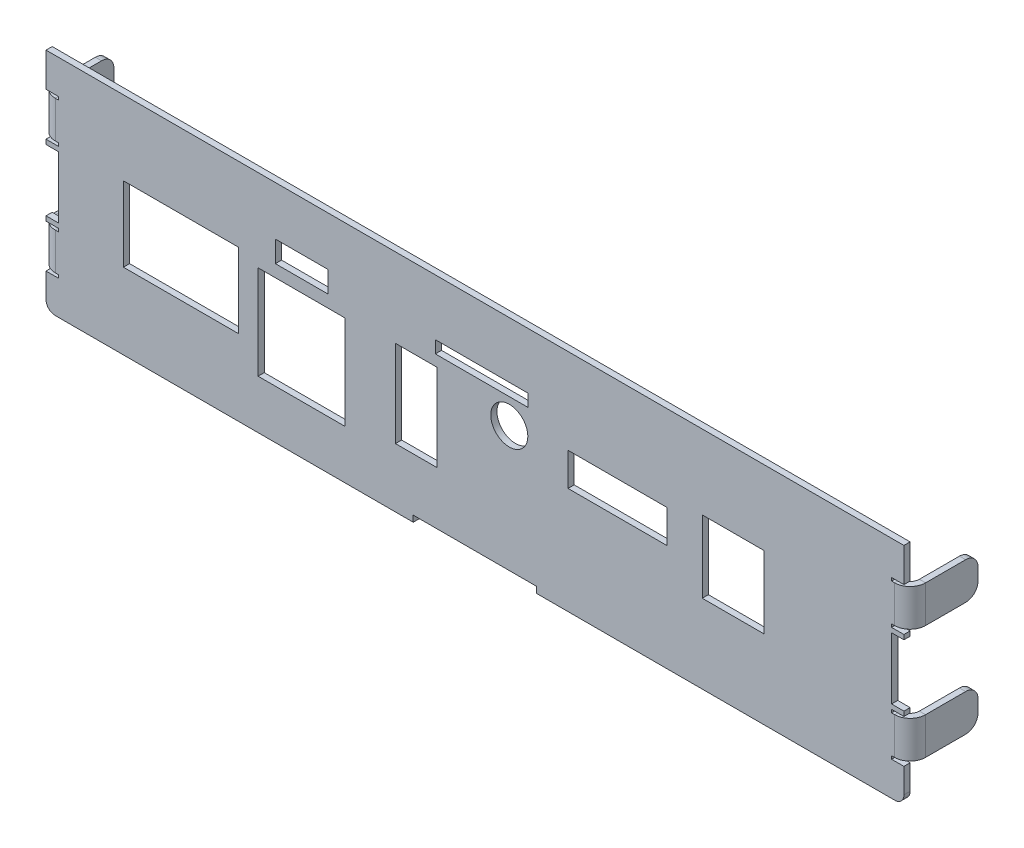
from build123d import *

# Parameters (mm, degrees)
SKETCH1_W                       = 139
SKETCH1_H                       = 36.5
BASE_FLANGE1_DEPTH              = 1
EDGE_FLANGE1_STRIP_W            = 7
EDGE_FLANGE1_STRIP_H            = 1
EDGE_FLANGE1_STRIP_CUT_DEPTH    = 6
EDGE_FLANGE1_RELIEF_W           = 7.5
EDGE_FLANGE1_RELIEF_H           = 0.5
EDGE_FLANGE1_RELIEF_CUT_DEPTH   = 1
EDGE_FLANGE1_STRIP_2_W          = 7
EDGE_FLANGE1_STRIP_2_H          = 1
EDGE_FLANGE1_STRIP_CUT_2_DEPTH  = 6
EDGE_FLANGE1_RELIEF_2_W         = 7.5
EDGE_FLANGE1_RELIEF_2_H         = 0.5
EDGE_FLANGE1_RELIEF_CUT_2_DEPTH = 1
EDGE_FLANGE1_DEPTH              = 6
EDGE_FLANGE1_START              = -1
EDGE_FLANGE1_FLAT_DEPTH         = 1
EDGE_FLANGE1_BEND_DEPTH         = 6
EDGE_FLANGE1_FLAT_2_DEPTH       = 1
EDGE_FLANGE2_STRIP_W            = 7
EDGE_FLANGE2_STRIP_H            = 1
EDGE_FLANGE2_STRIP_CUT_DEPTH    = 6
EDGE_FLANGE2_RELIEF_W           = 7.5
EDGE_FLANGE2_RELIEF_H           = 0.5
EDGE_FLANGE2_RELIEF_CUT_DEPTH   = 1
EDGE_FLANGE2_STRIP_2_W          = 7
EDGE_FLANGE2_STRIP_2_H          = 1
EDGE_FLANGE2_STRIP_CUT_2_DEPTH  = 6
EDGE_FLANGE2_RELIEF_2_W         = 7.5
EDGE_FLANGE2_RELIEF_2_H         = 0.5
EDGE_FLANGE2_RELIEF_CUT_2_DEPTH = 1
EDGE_FLANGE2_DEPTH              = 6
EDGE_FLANGE2_START              = 1
EDGE_FLANGE2_FLAT_DEPTH         = 1
EDGE_FLANGE2_BEND_DEPTH         = 6
EDGE_FLANGE2_FLAT_2_DEPTH       = 1
SKETCH20_W                      = 20
SKETCH20_H                      = 1
SKETCH20_W_2                    = 2
SKETCH20_H_2                    = 10
CUT_EXTRUDE1_DEPTH              = 10
FILLET1_R                       = 1.5
SKETCH21_W                      = 15
SKETCH21_H                      = 2
SKETCH21_W_2                    = 17.619171599
SKETCH21_H_2                    = 11.12514716
SKETCH21_W_3                    = 13.1
SKETCH21_H_3                    = 14.209512824
SKETCH21_W_4                    = 5.75
SKETCH21_H_4                    = 13.075429167
SKETCH21_H_5                    = 4.35
CUT_EXTRUDE2_DEPTH              = 10
SKETCH22_R                      = 3
SKETCH22_W                      = 8.50018288
SKETCH22_H                      = 3.45
SKETCH22_W_2                    = 10.00000232
SKETCH22_H_2                    = 11.697941419
SKETCH22_W_3                    = 18.619171599
SKETCH22_H_3                    = 12.12514716
SKETCH22_W_4                    = 17.619171599
SKETCH22_H_4                    = 11.12514716
SKETCH22_W_5                    = 14.1
SKETCH22_H_5                    = 15.209512824
SKETCH22_W_6                    = 13.1
SKETCH22_H_6                    = 14.209512824
SKETCH22_W_7                    = 6.75
SKETCH22_H_7                    = 14.075429167
SKETCH22_W_8                    = 5.75
SKETCH22_H_8                    = 13.075429167
SKETCH22_W_9                    = 16
SKETCH22_H_9                    = 5.35
SKETCH22_W_10                   = 15
SKETCH22_H_10                   = 4.35
CUT_EXTRUDE3_DEPTH              = 10


# Sheet-metal steps are written as plain solids
with BuildPart() as part:
    # Sketch1 → Base-Flange1 (new body)
    with BuildSketch(Plane.XY):
        with Locations((0.929014267, 0)):
            Rectangle(SKETCH1_W, SKETCH1_H)
    extrude(amount=-BASE_FLANGE1_DEPTH)

    # Edge-Flange1 strip (across the edge) → Edge-Flange1 strip cut (cut)
    with BuildSketch(Plane(origin=(-68.570985733, 6.25, -1), x_dir=(1, 0, 0), z_dir=(0, 1, 0))):
        with Locations((-2, -0.5)):
            Rectangle(EDGE_FLANGE1_STRIP_W, EDGE_FLANGE1_STRIP_H)
    extrude(amount=EDGE_FLANGE1_STRIP_CUT_DEPTH, mode=Mode.SUBTRACT)

    # Edge-Flange1 relief (on the sheet) → Edge-Flange1 relief cut (cut)
    with BuildSketch(Plane(origin=(-67.070985733, 6.25, -1), x_dir=(1, 0, 0), z_dir=(0, 0, -1))):
        with Locations((-3.25, 0.25)):
            Rectangle(EDGE_FLANGE1_RELIEF_W, EDGE_FLANGE1_RELIEF_H)
        with Locations((-3.25, -6.25)):
            Rectangle(EDGE_FLANGE1_RELIEF_W, EDGE_FLANGE1_RELIEF_H)
    extrude(amount=-EDGE_FLANGE1_RELIEF_CUT_DEPTH, mode=Mode.SUBTRACT)

    # Edge-Flange1 strip 2 (across the edge) → Edge-Flange1 strip cut 2 (cut)
    with BuildSketch(Plane(origin=(70.429014267, 12.25, -1), x_dir=(-1, 0, 0), z_dir=(0, -1, 0))):
        with Locations((-2, -0.5)):
            Rectangle(EDGE_FLANGE1_STRIP_2_W, EDGE_FLANGE1_STRIP_2_H)
    extrude(amount=EDGE_FLANGE1_STRIP_CUT_2_DEPTH, mode=Mode.SUBTRACT)

    # Edge-Flange1 relief 2 (on the sheet) → Edge-Flange1 relief cut 2 (cut)
    with BuildSketch(Plane(origin=(68.929014267, 12.25, -1), x_dir=(-1, 0, 0), z_dir=(0, 0, -1))):
        with Locations((-3.25, 0.25)):
            Rectangle(EDGE_FLANGE1_RELIEF_2_W, EDGE_FLANGE1_RELIEF_2_H)
        with Locations((-3.25, -6.25)):
            Rectangle(EDGE_FLANGE1_RELIEF_2_W, EDGE_FLANGE1_RELIEF_2_H)
    extrude(amount=-EDGE_FLANGE1_RELIEF_CUT_2_DEPTH, mode=Mode.SUBTRACT)

    # Edge-Flange1 bend section (across the edge) → Edge-Flange1 (add)
    with BuildSketch(Plane(origin=(-68.570985733, 6.25, -1), x_dir=(1, 0, 0), z_dir=(0, 1, 0))):
        with BuildLine():
            Line((-1, 1.5), (0, 1.5))
            ThreePointArc((0, 1.5), (0.439339828, 0.439339828), (1.5, 0))
            Line((1.5, 0), (1.5, -1))
            ThreePointArc((1.5, -1), (-0.267766953, -0.267766953), (-1, 1.5))
        make_face()
    extrude(amount=EDGE_FLANGE1_DEPTH)

    # Edge-Flange1 profile (on flange) → Edge-Flange1 flat (add)
    with BuildSketch(Plane(origin=(-68.570985733, 0, -1), x_dir=(0, -1, 0), z_dir=(1, 0, 0)).offset(EDGE_FLANGE1_START)):
        with BuildLine():
            ThreePointArc((-6.25, 8), (-6.835786438, 9.414213562), (-8.25, 10))
            Line((-8.25, 10), (-10.25, 10))
            ThreePointArc((-10.25, 10), (-11.664213562, 9.414213562), (-12.25, 8))
            Line((-12.25, 8), (-12.25, 1.5))
            Line((-12.25, 1.5), (-6.25, 1.5))
            Line((-6.25, 1.5), (-6.25, 8))
        make_face()
    extrude(amount=EDGE_FLANGE1_FLAT_DEPTH)

    # Edge-Flange1 bend section 2 (across the edge) → Edge-Flange1 bend (add)
    with BuildSketch(Plane(origin=(70.429014267, 12.25, -1), x_dir=(-1, 0, 0), z_dir=(0, -1, 0))):
        with BuildLine():
            Line((-1, 1.5), (0, 1.5))
            ThreePointArc((0, 1.5), (0.439339828, 0.439339828), (1.5, 0))
            Line((1.5, 0), (1.5, -1))
            ThreePointArc((1.5, -1), (-0.267766953, -0.267766953), (-1, 1.5))
        make_face()
    extrude(amount=EDGE_FLANGE1_BEND_DEPTH)

    # Edge-Flange1 profile 2 (on flange) → Edge-Flange1 flat 2 (add)
    with BuildSketch(Plane(origin=(70.429014267, 0, -1), x_dir=(0, 1, 0), z_dir=(-1, 0, 0)).offset(EDGE_FLANGE1_START)):
        with BuildLine():
            Line((12.25, 1.5), (12.25, 8))
            ThreePointArc((12.25, 8), (11.664213562, 9.414213562), (10.25, 10))
            Line((10.25, 10), (8.25, 10))
            ThreePointArc((8.25, 10), (6.835786438, 9.414213562), (6.25, 8))
            Line((6.25, 8), (6.25, 1.5))
            Line((6.25, 1.5), (12.25, 1.5))
        make_face()
    extrude(amount=EDGE_FLANGE1_FLAT_2_DEPTH)

    # Edge-Flange2 strip (across the edge) → Edge-Flange2 strip cut (cut)
    with BuildSketch(Plane(origin=(70.429014267, -6.25, -1), x_dir=(-1, 0, 0), z_dir=(0, -1, 0))):
        with Locations((-2, -0.5)):
            Rectangle(EDGE_FLANGE2_STRIP_W, EDGE_FLANGE2_STRIP_H)
    extrude(amount=EDGE_FLANGE2_STRIP_CUT_DEPTH, mode=Mode.SUBTRACT)

    # Edge-Flange2 relief (on the sheet) → Edge-Flange2 relief cut (cut)
    with BuildSketch(Plane(origin=(68.929014267, -6.25, -1), x_dir=(-1, 0, 0), z_dir=(0, 0, -1))):
        with Locations((-3.25, 0.25)):
            Rectangle(EDGE_FLANGE2_RELIEF_W, EDGE_FLANGE2_RELIEF_H)
        with Locations((-3.25, -6.25)):
            Rectangle(EDGE_FLANGE2_RELIEF_W, EDGE_FLANGE2_RELIEF_H)
    extrude(amount=-EDGE_FLANGE2_RELIEF_CUT_DEPTH, mode=Mode.SUBTRACT)

    # Edge-Flange2 strip 2 (across the edge) → Edge-Flange2 strip cut 2 (cut)
    with BuildSketch(Plane(origin=(-68.570985733, -12.25, -1), x_dir=(1, 0, 0), z_dir=(0, 1, 0))):
        with Locations((-2, -0.5)):
            Rectangle(EDGE_FLANGE2_STRIP_2_W, EDGE_FLANGE2_STRIP_2_H)
    extrude(amount=EDGE_FLANGE2_STRIP_CUT_2_DEPTH, mode=Mode.SUBTRACT)

    # Edge-Flange2 relief 2 (on the sheet) → Edge-Flange2 relief cut 2 (cut)
    with BuildSketch(Plane(origin=(-67.070985733, -12.25, -1), x_dir=(1, 0, 0), z_dir=(0, 0, -1))):
        with Locations((-3.25, 0.25)):
            Rectangle(EDGE_FLANGE2_RELIEF_2_W, EDGE_FLANGE2_RELIEF_2_H)
        with Locations((-3.25, -6.25)):
            Rectangle(EDGE_FLANGE2_RELIEF_2_W, EDGE_FLANGE2_RELIEF_2_H)
    extrude(amount=-EDGE_FLANGE2_RELIEF_CUT_2_DEPTH, mode=Mode.SUBTRACT)

    # Edge-Flange2 bend section (across the edge) → Edge-Flange2 (add)
    with BuildSketch(Plane(origin=(70.429014267, -6.25, -1), x_dir=(-1, 0, 0), z_dir=(0, -1, 0))):
        with BuildLine():
            Line((-1, 1.5), (0, 1.5))
            ThreePointArc((0, 1.5), (0.439339828, 0.439339828), (1.5, 0))
            Line((1.5, 0), (1.5, -1))
            ThreePointArc((1.5, -1), (-0.267766953, -0.267766953), (-1, 1.5))
        make_face()
    extrude(amount=EDGE_FLANGE2_DEPTH)

    # Edge-Flange2 profile (on flange) → Edge-Flange2 flat (add)
    with BuildSketch(Plane(origin=(70.429014267, 0, -1), x_dir=(0, -1, 0), z_dir=(1, 0, 0)).offset(EDGE_FLANGE2_START)):
        with BuildLine():
            Line((12.25, 1.5), (12.25, 8))
            ThreePointArc((12.25, 8), (11.664213562, 9.414213562), (10.25, 10))
            Line((10.25, 10), (8.25, 10))
            ThreePointArc((8.25, 10), (6.835786438, 9.414213562), (6.25, 8))
            Line((6.25, 8), (6.25, 1.5))
            Line((6.25, 1.5), (12.25, 1.5))
        make_face()
    extrude(amount=-EDGE_FLANGE2_FLAT_DEPTH)

    # Edge-Flange2 bend section 2 (across the edge) → Edge-Flange2 bend (add)
    with BuildSketch(Plane(origin=(-68.570985733, -12.25, -1), x_dir=(1, 0, 0), z_dir=(0, 1, 0))):
        with BuildLine():
            Line((-1, 1.5), (0, 1.5))
            ThreePointArc((0, 1.5), (0.439339828, 0.439339828), (1.5, 0))
            Line((1.5, 0), (1.5, -1))
            ThreePointArc((1.5, -1), (-0.267766953, -0.267766953), (-1, 1.5))
        make_face()
    extrude(amount=EDGE_FLANGE2_BEND_DEPTH)

    # Edge-Flange2 profile 2 (on flange) → Edge-Flange2 flat 2 (add)
    with BuildSketch(Plane(origin=(-68.570985733, 0, -1), x_dir=(0, 1, 0), z_dir=(-1, 0, 0)).offset(EDGE_FLANGE2_START)):
        with BuildLine():
            ThreePointArc((-6.25, 8), (-6.835786438, 9.414213562), (-8.25, 10))
            Line((-8.25, 10), (-10.25, 10))
            ThreePointArc((-10.25, 10), (-11.664213562, 9.414213562), (-12.25, 8))
            Line((-12.25, 8), (-12.25, 1.5))
            Line((-12.25, 1.5), (-6.25, 1.5))
            Line((-6.25, 1.5), (-6.25, 8))
        make_face()
    extrude(amount=-EDGE_FLANGE2_FLAT_2_DEPTH)

    # Sketch20 → Cut-Extrude1 (cut)
    with BuildSketch(Plane(origin=(0, 0, -1), x_dir=(-1, 0, 0), z_dir=(0, 0, -1))):
        with Locations((-0.929014267, -17.75)):
            Rectangle(SKETCH20_W, SKETCH20_H)
        with Locations((-69.429014267, 0)):
            Rectangle(SKETCH20_W_2, SKETCH20_H_2)
        with Locations((67.570985733, 0)):
            Rectangle(SKETCH20_W_2, SKETCH20_H_2)
    extrude(amount=-CUT_EXTRUDE1_DEPTH, mode=Mode.SUBTRACT)

    # Fillet1
    fillet1_edges = [part.edges().sort_by_distance(p)[0] for p in [
        (70.429014267, -18.25, -0.5),
        (-68.570985733, -18.25, -0.5),
    ]]
    fillet(fillet1_edges, radius=FILLET1_R)

    # Sketch21 → Cut-Extrude2 (cut)
    with BuildSketch(Plane.XY):
        with Locations((2.010056647, 8.16084548)):
            Rectangle(SKETCH21_W, SKETCH21_H)
        with Locations((-46.719481313, 0.12237266)):
            Rectangle(SKETCH21_W_2, SKETCH21_H_2)
        with Locations((-27.159885853, -2.720244568)):
            Rectangle(SKETCH21_W_3, SKETCH21_H_3)
        with Locations((-8.575130533, -1.617166732)):
            Rectangle(SKETCH21_W_4, SKETCH21_H_4)
        with Locations((24.006575187, 1.71009184)):
            Rectangle(SKETCH21_W, SKETCH21_H_5)
    extrude(amount=-CUT_EXTRUDE2_DEPTH, mode=Mode.SUBTRACT)

    # Sketch22 → Cut-Extrude3 (cut)
    # profile 1 of 7: a face of its own
    with BuildSketch(Plane.XY):
        with Locations((6.490209407, 3.08500012)):
            Circle(SKETCH22_R)
    # profile 2 of 7: a face of its own
    with BuildSketch(Plane.XY):
        with Locations((-27.159977293, 8.5910876)):
            Rectangle(SKETCH22_W, SKETCH22_H)
    # profile 3 of 7: a face of its own
    with BuildSketch(Plane.XY):
        with Locations((42.755059407, 0.349211789)):
            Rectangle(SKETCH22_W_2, SKETCH22_H_2)
    # profile 4 of 7: a face of its own
    with BuildSketch(Plane.XY):
        with Locations((-46.719481313, 0.12237266)):
            Rectangle(SKETCH22_W_3, SKETCH22_H_3)
        with Locations((-46.719481313, 0.12237266)):
            Rectangle(SKETCH22_W_4, SKETCH22_H_4, mode=Mode.SUBTRACT)
    # profile 5 of 7: a face of its own
    with BuildSketch(Plane.XY):
        with Locations((-27.159885853, -2.720244568)):
            Rectangle(SKETCH22_W_5, SKETCH22_H_5)
        with Locations((-27.159885853, -2.720244568)):
            Rectangle(SKETCH22_W_6, SKETCH22_H_6, mode=Mode.SUBTRACT)
    # profile 6 of 7: a face of its own
    with BuildSketch(Plane.XY):
        with Locations((-8.575130533, -1.617166732)):
            Rectangle(SKETCH22_W_7, SKETCH22_H_7)
        with Locations((-8.575130533, -1.617166732)):
            Rectangle(SKETCH22_W_8, SKETCH22_H_8, mode=Mode.SUBTRACT)
    # profile 7 of 7: a face of its own
    with BuildSketch(Plane.XY):
        with Locations((24.006575187, 1.71009184)):
            Rectangle(SKETCH22_W_9, SKETCH22_H_9)
        with Locations((24.006575187, 1.71009184)):
            Rectangle(SKETCH22_W_10, SKETCH22_H_10, mode=Mode.SUBTRACT)
    extrude(amount=-CUT_EXTRUDE3_DEPTH, mode=Mode.SUBTRACT)


solid = part.part
